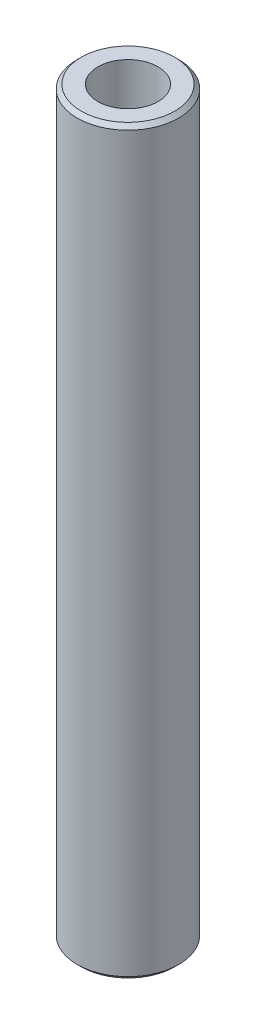
from build123d import *

# Parameters (mm, degrees)
SKETCH1_R           = 37.5
BOSS_EXTRUDE1_DEPTH = 547.492536188
SKETCH2_R           = 22.261030184
CUT_EXTRUDE1_DEPTH  = 551.055067408
CHAMFER1_SIZE       = 2.954254195


with BuildPart() as part:
    # Sketch1 → Boss-Extrude1 (new body)
    with BuildSketch(Plane(origin=(0, 0, 0), x_dir=(1, 0, 0), z_dir=(0, 1, 0))):
        Circle(SKETCH1_R)
    extrude(amount=BOSS_EXTRUDE1_DEPTH)

    # Sketch2 → Cut-Extrude1 (cut, through all)
    with BuildSketch(Plane(origin=(0, 0, 0), x_dir=(1, 0, 0), z_dir=(0, 1, 0))):
        Circle(SKETCH2_R)
    extrude(amount=CUT_EXTRUDE1_DEPTH, mode=Mode.SUBTRACT)

    # Chamfer1
    chamfer1_edges = [part.edges().sort_by_distance(p)[0] for p in [
        (-37.5, 547.492536188, 0),
        (-37.5, 0, 0),
    ]]
    chamfer(chamfer1_edges, length=CHAMFER1_SIZE)


solid = part.part
